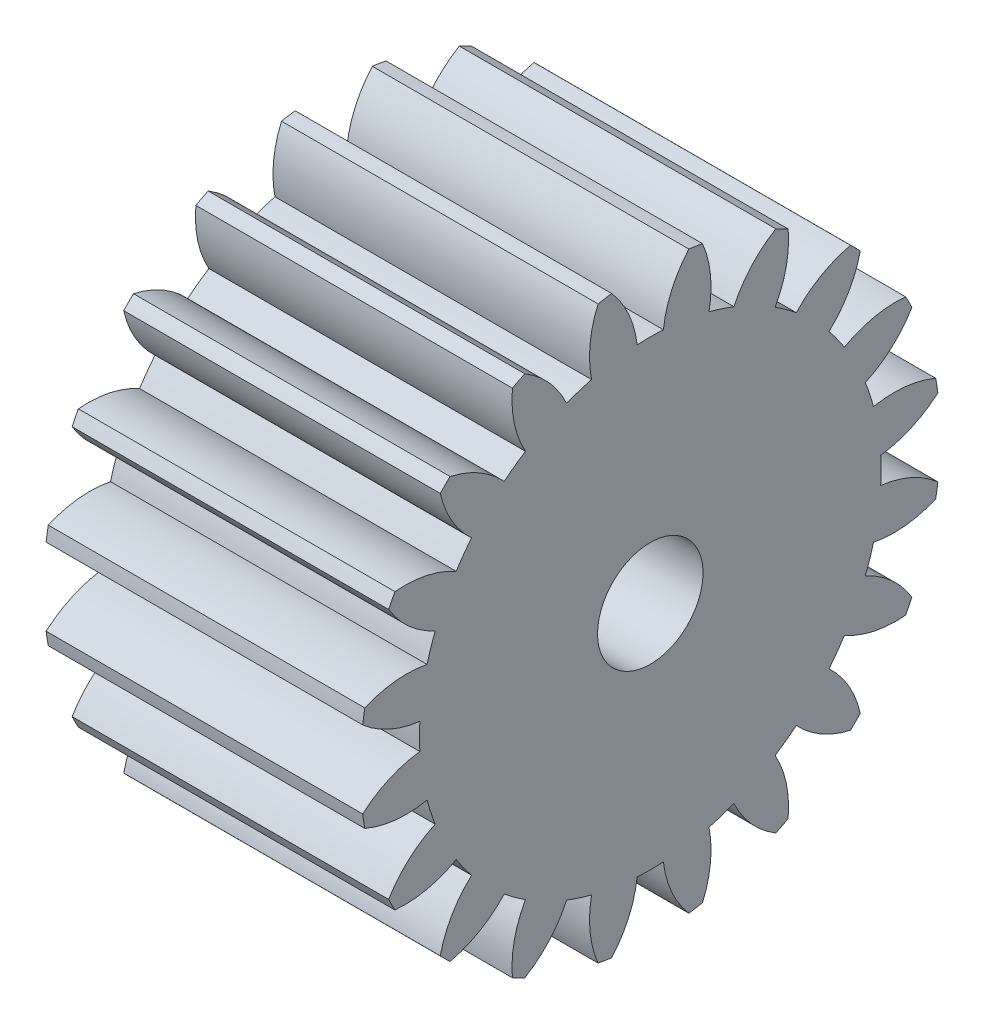
from build123d import *

# Parameters (mm, degrees)
BASPROSKE_W     = 15
BASPROSKE_H     = 13.75
TOOTHCUT_DEPTH  = 25.55860338
TEETHCUTS_COUNT = 20
TEETHCUTS_ANGLE = 342
BORSKE_R        = 2.5
BORE_DEPTH      = 50.0000508


with BuildPart() as part:
    # BasProSke → Base-Revolve (revolve)
    with BuildSketch(Plane(origin=(0, 0, 0), x_dir=(1, 0, 0), z_dir=(0, 1, 0))):
        with Locations((7.5, 6.875)):
            Rectangle(BASPROSKE_W, BASPROSKE_H)
    revolve(axis=Axis((-10, 0, 0), (1, 0, 0)))

    # TooCutSke → ToothCut (cut, through all)
    with BuildSketch(Plane(origin=(0, 0, 0), x_dir=(0, 0, -1), z_dir=(1, 0, 0))):
        with BuildLine():
            ThreePointArc((0.62110296, 10.918848994), (0, 10.9365), (-0.62110296, 10.918848994))
            ThreePointArc((-0.62110296, 10.918848994), (-1.024517052, 12.378857135), (-1.846615859, 13.651067908))
            ThreePointArc((-1.846615859, 13.651067908), (0, 13.7754), (1.846615859, 13.651067908))
            ThreePointArc((1.846615859, 13.651067908), (1.024517052, 12.378857135), (0.62110296, 10.918848994))
        make_face()
    toothcut = extrude(amount=TOOTHCUT_DEPTH, mode=Mode.SUBTRACT)

    # TeethCuts: ToothCut ×20 about axis
    teethcuts_axis = Axis((-10, 0, 0), (1, 0, 0))
    for i in range(1, TEETHCUTS_COUNT):
        add(toothcut.rotate(teethcuts_axis, i * TEETHCUTS_ANGLE / (TEETHCUTS_COUNT - 1)), mode=Mode.SUBTRACT)

    # BorSke → Bore (cut, symmetric)
    with BuildSketch(Plane(origin=(0, 0, 0), x_dir=(0, 0, -1), z_dir=(1, 0, 0))):
        Circle(BORSKE_R)
    extrude(amount=BORE_DEPTH, both=True, mode=Mode.SUBTRACT)


solid = part.part
